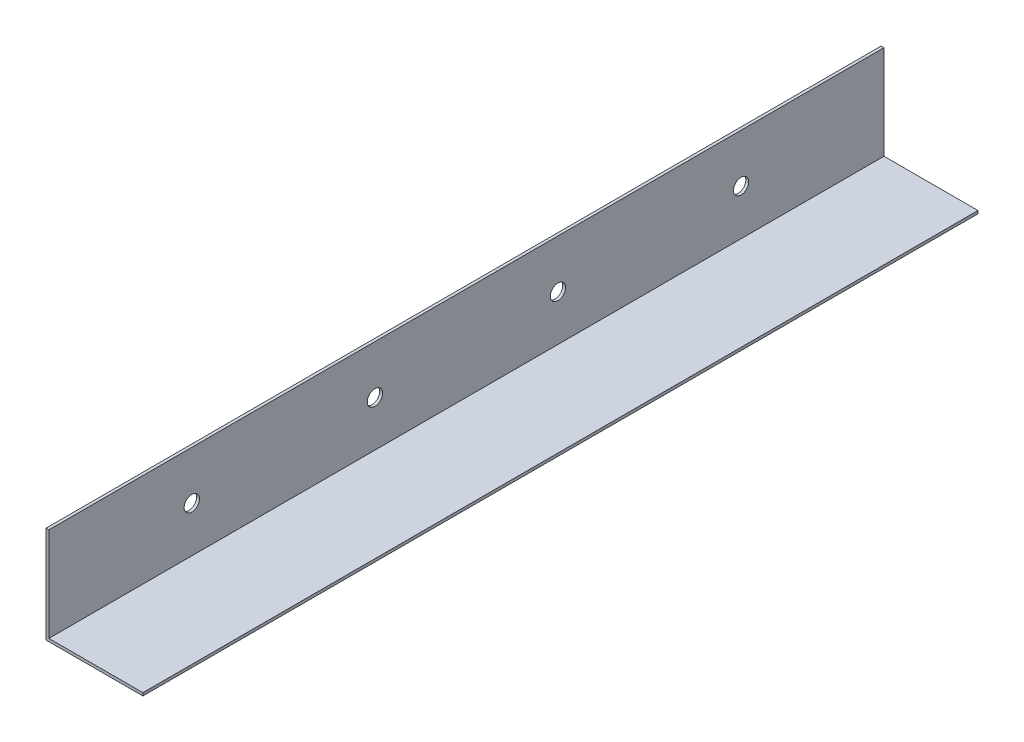
from build123d import *

# Parameters (mm, degrees)
SALIENTE_EXTRUIR1_DEPTH = 437.896
CROQUIS2_R              = 3.999992
CORTAR_EXTRUIR1_DEPTH   = 4.064


with BuildPart() as part:
    # Croquis1 → Saliente-Extruir1 (new body)
    with BuildSketch(Plane.XY):
        Polygon((0, 0), (0, 50.8), (1.499997, 50.8), (1.499997, 1.499997), (50.8, 1.499997), (50.8, 0), align=None)
    extrude(amount=SALIENTE_EXTRUIR1_DEPTH)

    # Croquis2 → Cortar-Extruir1 (cut)
    with BuildSketch(Plane.ZY):
        with Locations((266.948, 25.4)):
            Circle(CROQUIS2_R)
        with Locations((362.948, 25.4)):
            Circle(CROQUIS2_R)
        with Locations((74.948, 25.4)):
            Circle(CROQUIS2_R)
        with Locations((170.948, 25.4)):
            Circle(CROQUIS2_R)
    extrude(amount=-CORTAR_EXTRUIR1_DEPTH, mode=Mode.SUBTRACT)


solid = part.part
